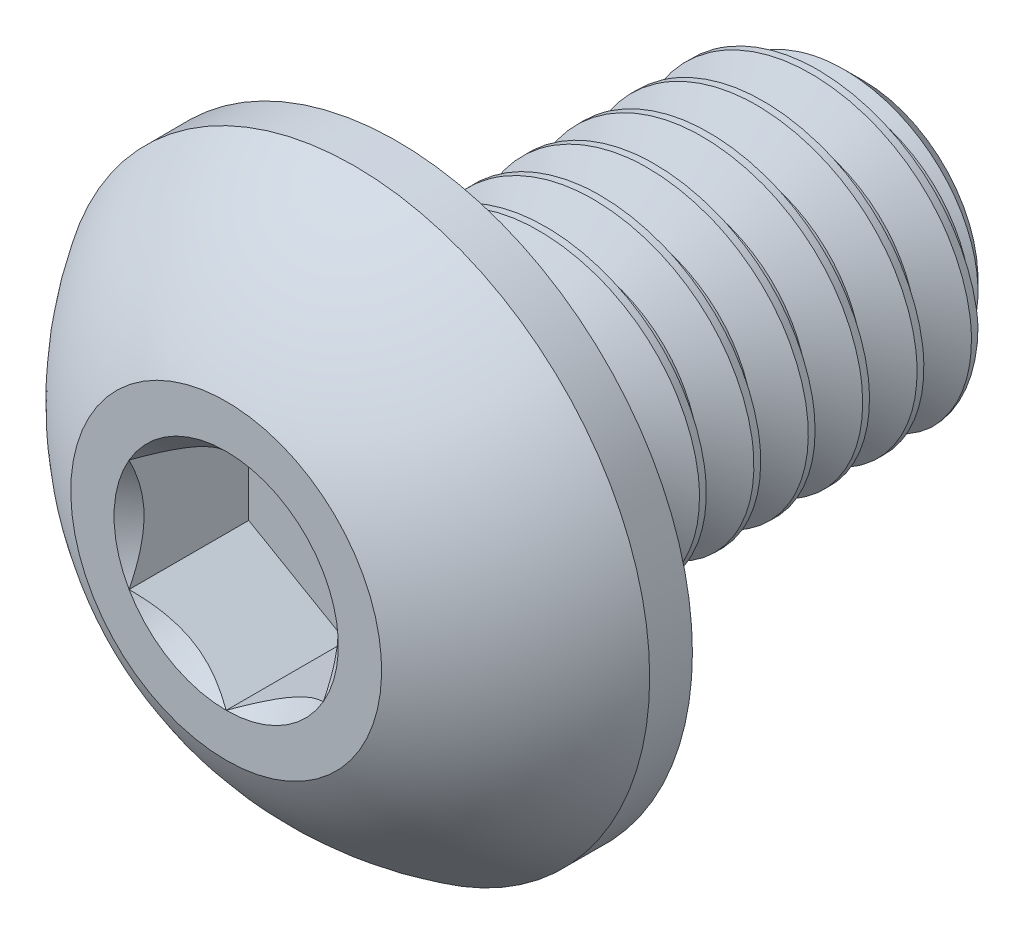
from build123d import *

# Parameters (mm, degrees)
SKETCH1_W          = 6
SKETCH1_H          = 2
CHAMFER1_SIZE      = 0.525
CUT_SWEEP1_PITCH   = 0.7
CUT_EXTRUDE2_DEPTH = 1.54
SKETCH14_R         = 0.5842
CUT_EXTRUDE6_DEPTH = 10.804080861


with BuildPart() as part:
    # Sketch1 → Revolve1 (revolve)
    with BuildSketch(Plane(origin=(0, 0, 0), x_dir=(0, 0, -1), z_dir=(1, 0, 0))):
        with Locations((5.2, 1)):
            Rectangle(SKETCH1_W, SKETCH1_H)
    revolve(axis=Axis((0, 0, -8.2), (0, 0, 1)))

    # Chamfer1
    chamfer1_edges = [part.edges().sort_by_distance(p)[0] for p in [
        (0, -2, -8.2),
    ]]
    chamfer(chamfer1_edges, length=CHAMFER1_SIZE)

    # Cut-Sweep1: the profile of Sketch2 profile screwed along a right-hand helix of 9.571429 turns, 6 arcs to a turn; built about Z, then put on its axis
    cut_sweep1_z = Axis((0, 0, 0), (0, 0, 1))
    cut_sweep1_corners = [(2.0003, 0, 0.000173205), (2.0003, 0, -0.612673205), (1.545336663, 0, -0.35), (1.545336663, 0, -0.2625)]
    with BuildLine(mode=Mode.PRIVATE) as cut_sweep1_profile:
        Line(cut_sweep1_corners[0], cut_sweep1_corners[1])
        Line(cut_sweep1_corners[1], cut_sweep1_corners[2])
        Line(cut_sweep1_corners[2], cut_sweep1_corners[3])
        Line(cut_sweep1_corners[3], cut_sweep1_corners[0])
    cut_sweep1_cap = Face(cut_sweep1_profile.wire())
    cut_sweep1_turn_angles = [0, 30, 60, 90, 120, 150, 180, 210, 240, 270, 300, 330, 360]
    cut_sweep1_turn_weights = [1, 0.8660254037844387, 1, 0.8660254037844387, 1, 0.8660254037844387, 1, 0.8660254037844387, 1, 0.8660254037844387, 1, 0.8660254037844387, 1]
    cut_sweep1_turn_rails = [Edge.make_bspline([Vector(p[0], p[1], 0).rotate(cut_sweep1_z, cut_sweep1_turn_angles[k]) / cut_sweep1_turn_weights[k] + Vector(0, 0, p[2] + CUT_SWEEP1_PITCH * cut_sweep1_turn_angles[k] / 360) for k in range(13)], [0, 0, 0, 1, 1, 2, 2, 3, 3, 4, 4, 5, 5, 6, 6, 6], 2, cut_sweep1_turn_weights) for p in cut_sweep1_corners]
    cut_sweep1_turn_sides = [Face.make_surface_from_curves(cut_sweep1_turn_rails[p[0]], cut_sweep1_turn_rails[p[1]]) for p in [(0, 1), (1, 2), (2, 3), (3, 0)]]
    cut_sweep1_last_angles = [3240, 3270, 3300, 3330, 3360, 3390, 3420, 3432.857142857, 3445.714285714]
    cut_sweep1_last_weights = [1, 0.8660254037844387, 1, 0.8660254037844387, 1, 0.8660254037844387, 1, 0.9749279121818429, 1]
    cut_sweep1_last_rails = [Edge.make_bspline([Vector(p[0], p[1], 0).rotate(cut_sweep1_z, cut_sweep1_last_angles[k]) / cut_sweep1_last_weights[k] + Vector(0, 0, p[2] + CUT_SWEEP1_PITCH * cut_sweep1_last_angles[k] / 360) for k in range(9)], [0, 0, 0, 1, 1, 2, 2, 3, 3, 4, 4, 4], 2, cut_sweep1_last_weights) for p in cut_sweep1_corners]
    cut_sweep1_last_sides = [Face.make_surface_from_curves(cut_sweep1_last_rails[p[0]], cut_sweep1_last_rails[p[1]]) for p in [(0, 1), (1, 2), (2, 3), (3, 0)]]
    cut_sweep1 = Plane(origin=(0, 0, -8.2), x_dir=(0, 1, 0), z_dir=(0, 0, 1)) * Solid(Shell([*[p.moved(Location((0, 0, CUT_SWEEP1_PITCH * i))) for i in range(9) for p in cut_sweep1_turn_sides], *cut_sweep1_last_sides, cut_sweep1_cap, cut_sweep1_cap.rotate(cut_sweep1_z, 3445.714285714).moved(Location((0, 0, CUT_SWEEP1_PITCH * 3445.714285714 / 360)))]))
    add(cut_sweep1, mode=Mode.SUBTRACT)

    # Sketch7 → Revolve2 (revolve)
    with BuildSketch(Plane(origin=(0, 0, 0), x_dir=(0, 0, -1), z_dir=(1, 0, 0)), mode=Mode.PRIVATE) as revolve2_sk:
        with BuildLine():
            Line((1.65, 3.8), (2.2, 3.8))
            Line((2.2, 3.8), (2.2, 0))
            Line((2.2, 0), (0, 0))
            Line((0, 0), (0, 2))
            ThreePointArc((0, 2), (0.69947309, 3.015066334), (1.65, 3.8))
        make_face()
    revolve(revolve2_sk.sketch.rotate(Axis((0, 0, 0), (0, 0, -1)), 189.336081704), axis=Axis((0, 0, 0), (0, 0, -1)))

    # Sketch5 → Cut-Extrude2 (cut)
    with BuildSketch(Plane.XY):
        Polygon((1.25, -0.721687836), (1.25, 0.721687836), (0, 1.443375673), (-1.25, 0.721687836), (-1.25, -0.721687836), (0, -1.443375673), align=None)
    extrude(amount=-CUT_EXTRUDE2_DEPTH, mode=Mode.SUBTRACT)

    # Cut-Extrude3 cone 1 section (through the dimple's axis) → Cut-Extrude3 (revolve, cut)
    with BuildSketch(Plane(origin=(0, 0, 0), x_dir=(0, -1, 0), z_dir=(1, 0, 0))):
        Polygon((0, 0), (1.443375673, 0), (0, 1.443375673), align=None)
    revolve(axis=Axis((0, 0, 0), (0, 0, -1)), mode=Mode.SUBTRACT)

    # Sketch14 → Cut-Extrude6 (cut, through all)
    with BuildSketch(Plane(origin=(0, 0, -8.2), x_dir=(-1, 0, 0), z_dir=(0, 0, -1))):
        with Locations(Location((0, 0, 0), (0, 0, 90))):
            Circle(SKETCH14_R)
    extrude(amount=-CUT_EXTRUDE6_DEPTH, mode=Mode.SUBTRACT)


solid = part.part
